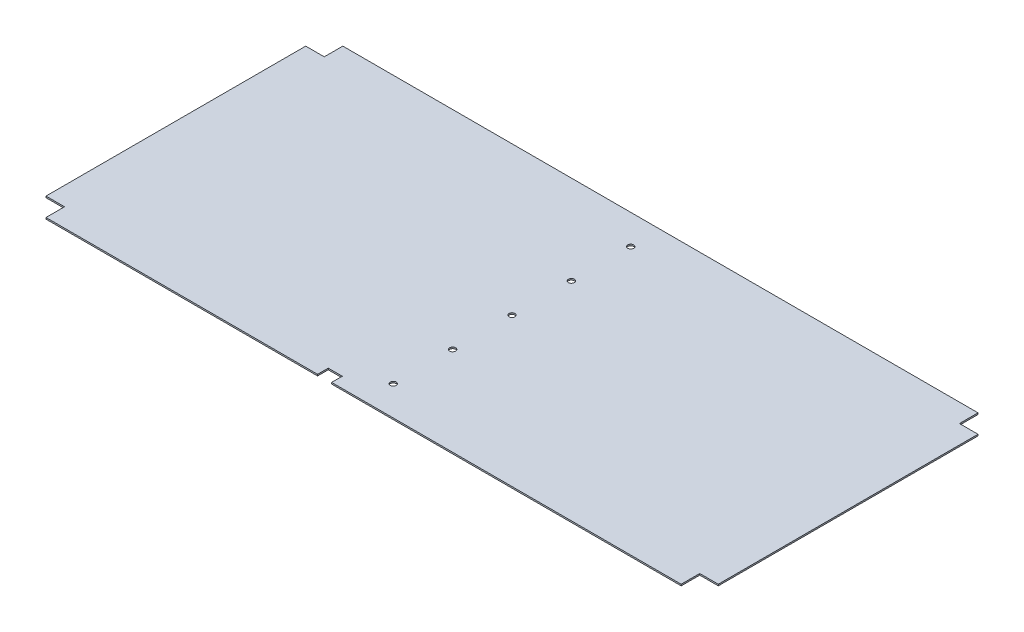
from build123d import *

# Parameters (mm, degrees)
IZIM1_W               = 906
IZIM1_H               = 400
TABAN_FLAN_1_DEPTH    = 2
IZIM6_W               = 25
IZIM6_H               = 25
KES_EKSTR_ZYON1_DEPTH = 10
IZIM7_R               = 4
KES_EKSTR_ZYON2_DEPTH = 10
IZIM8_W               = 18.951494712
IZIM8_H               = 21.871958868
KES_EKSTR_ZYON3_DEPTH = 10


# Sheet-metal steps are written as plain solids
with BuildPart() as part:
    # Çizim1 → Taban-Flanş1 (new body)
    with BuildSketch(Plane(origin=(0, 0, 0), x_dir=(1, 0, 0), z_dir=(0, 1, 0))):
        with Locations((0, 200)):
            Rectangle(IZIM1_W, IZIM1_H)
    extrude(amount=-TABAN_FLAN_1_DEPTH)

    # Çizim6 → Kes-Ekstrüzyon1 (cut)
    with BuildSketch(Plane.XZ.offset(2)):
        with Locations((-440.5, -12.5)):
            Rectangle(IZIM6_W, IZIM6_H)
        with Locations((440.5, -12.5)):
            Rectangle(IZIM6_W, IZIM6_H)
        with Locations((440.5, -387.5)):
            Rectangle(IZIM6_W, IZIM6_H)
        with Locations((-440.5, -387.5)):
            Rectangle(IZIM6_W, IZIM6_H)
    extrude(amount=-KES_EKSTR_ZYON1_DEPTH, mode=Mode.SUBTRACT)

    # Çizim7 → Kes-Ekstrüzyon2 (cut)
    with BuildSketch(Plane(origin=(0, 0, 0), x_dir=(1, 0, 0), z_dir=(0, 1, 0))):
        with Locations(Location((0, 360, 0), (0, 0, 270))):
            Circle(IZIM7_R)
        with Locations(Location((0, 280, 0), (0, 0, 270))):
            Circle(IZIM7_R)
        with Locations(Location((0, 200, 0), (0, 0, 270))):
            Circle(IZIM7_R)
        with Locations(Location((0, 120, 0), (0, 0, 270))):
            Circle(IZIM7_R)
        with Locations(Location((0, 40, 0), (0, 0, 270))):
            Circle(IZIM7_R)
    extrude(amount=-KES_EKSTR_ZYON2_DEPTH, mode=Mode.SUBTRACT)

    # Çizim8 → Kes-Ekstrüzyon3 (cut)
    with BuildSketch(Plane(origin=(0, 0, 0), x_dir=(1, 0, 0), z_dir=(0, 1, 0))):
        with Locations((-52.524252644, 3.435979434)):
            Rectangle(IZIM8_W, IZIM8_H)
    extrude(amount=-KES_EKSTR_ZYON3_DEPTH, mode=Mode.SUBTRACT)


solid = part.part
